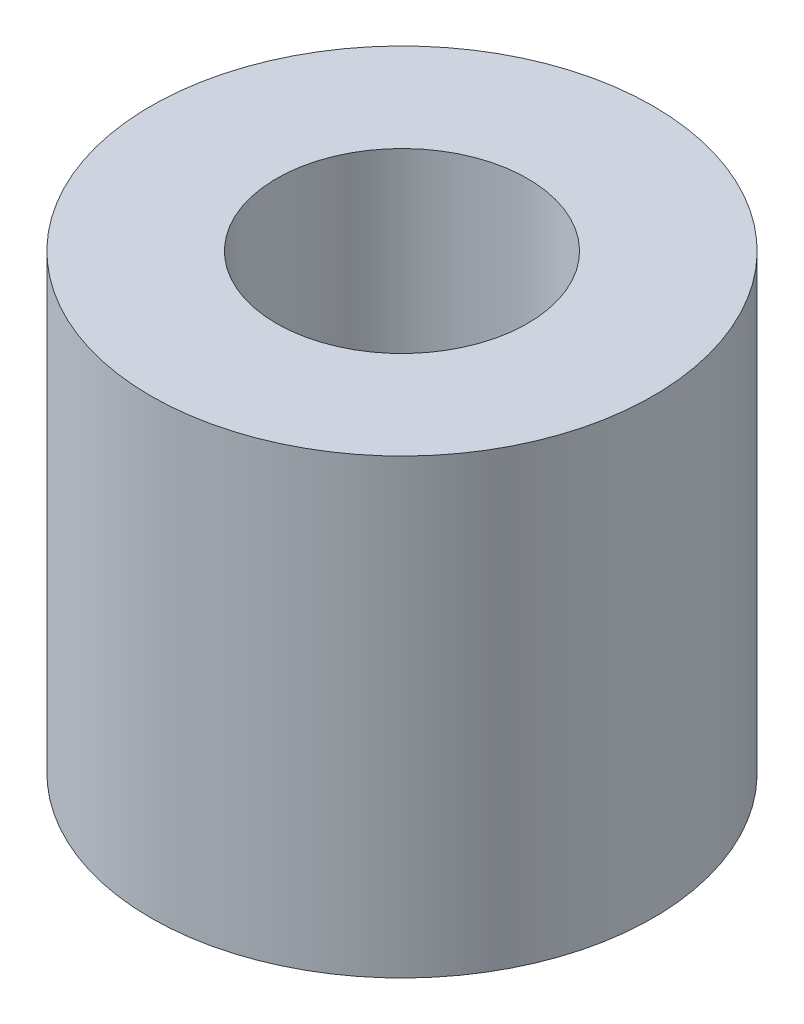
from build123d import *

# Parameters (mm, degrees)
SKETCH1_R           = 5
SKETCH1_R_2         = 2.5
BOSS_EXTRUDE1_DEPTH = 9


with BuildPart() as part:
    # Sketch1 → Boss-Extrude1 (new body)
    with BuildSketch(Plane(origin=(0, 0, 0), x_dir=(1, 0, 0), z_dir=(0, 1, 0))):
        Circle(SKETCH1_R)
        Circle(SKETCH1_R_2, mode=Mode.SUBTRACT)
    extrude(amount=BOSS_EXTRUDE1_DEPTH)


solid = part.part
